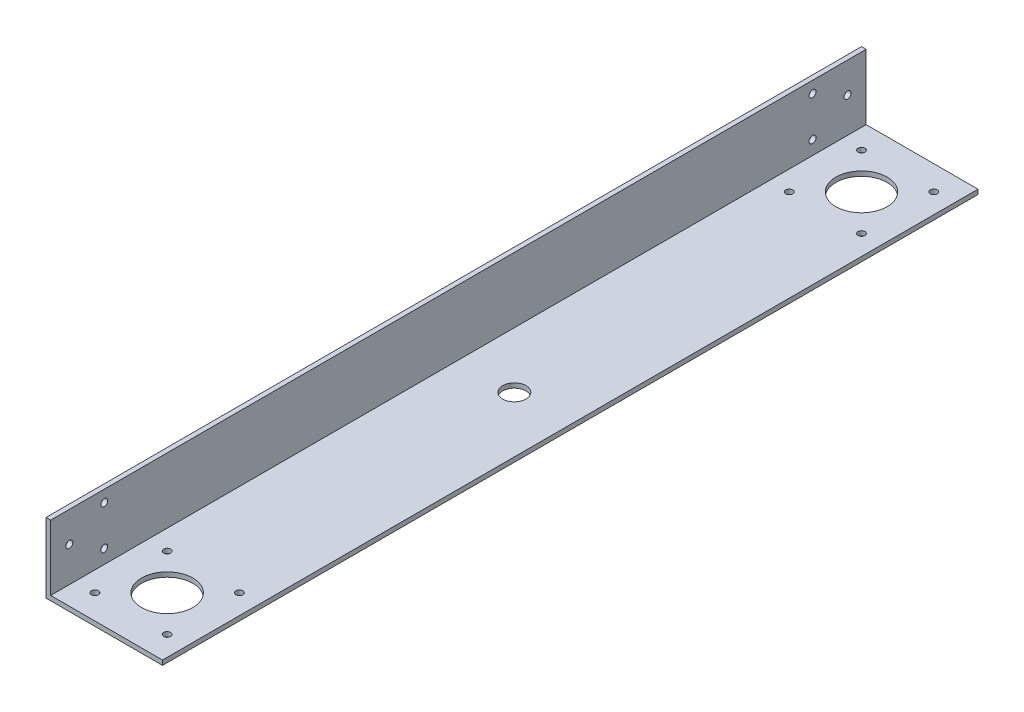
from build123d import *

# Parameters (mm, degrees)
BOSS_EXTRUDE1_DEPTH      = 350
SKETCH6_R                = 1.5
CUT_EXTRUDE3_DEPTH       = 355.660400947
SKETCH7_R                = 11
CUT_EXTRUDE4_DEPTH       = 355.660400947
SKETCH8_R                = 11
CUT_EXTRUDE5_DEPTH       = 355.823899984
SKETCH9_R                = 1.5
CUT_EXTRUDE6_DEPTH       = 355.823899984
SKETCH10_R               = 5
CUT_EXTRUDE7_DEPTH       = 355.823899984
F_3_0_3_DIAMETER_HOLE1_D = 3
F_3_0_3_DIAMETER_HOLE2_D = 3


with BuildPart() as part:
    # Sketch1 → Boss-Extrude1 (new body)
    with BuildSketch(Plane.XY):
        Polygon((0, 0), (0, 30), (2, 30), (2, 2), (50, 2), (50, 0), align=None)
    extrude(amount=BOSS_EXTRUDE1_DEPTH)

    # Sketch6 → Cut-Extrude3 (cut, through all)
    with BuildSketch(Plane(origin=(0, 2, 0), x_dir=(1, 0, 0), z_dir=(0, 1, 0))):
        with Locations((41.5, -339.5)):
            Circle(SKETCH6_R)
        with Locations((10.5, -308.5)):
            Circle(SKETCH6_R)
        with Locations((10.5, -339.5)):
            Circle(SKETCH6_R)
        with Locations((41.5, -308.5)):
            Circle(SKETCH6_R)
    extrude(amount=-CUT_EXTRUDE3_DEPTH, mode=Mode.SUBTRACT)

    # Sketch7 → Cut-Extrude4 (cut, through all)
    with BuildSketch(Plane(origin=(0, 2, 0), x_dir=(1, 0, 0), z_dir=(0, 1, 0))):
        with Locations((26, -324)):
            Circle(SKETCH7_R)
    extrude(amount=-CUT_EXTRUDE4_DEPTH, mode=Mode.SUBTRACT)

    # Sketch8 → Cut-Extrude5 (cut, through all)
    with BuildSketch(Plane(origin=(0, 0, 0), x_dir=(-1, 0, 0), z_dir=(0, -1, 0))):
        with Locations((-26, -26)):
            Circle(SKETCH8_R)
    extrude(amount=-CUT_EXTRUDE5_DEPTH, mode=Mode.SUBTRACT)

    # Sketch9 → Cut-Extrude6 (cut, through all)
    with BuildSketch(Plane.XZ):
        with Locations((41.5, 41.5)):
            Circle(SKETCH9_R)
        with Locations((10.5, 41.5)):
            Circle(SKETCH9_R)
        with Locations((10.5, 10.5)):
            Circle(SKETCH9_R)
        with Locations((41.5, 10.5)):
            Circle(SKETCH9_R)
    extrude(amount=-CUT_EXTRUDE6_DEPTH, mode=Mode.SUBTRACT)

    # Sketch10 → Cut-Extrude7 (cut, through all)
    with BuildSketch(Plane.XZ):
        with Locations((26.000000572, 175)):
            Circle(SKETCH10_R)
    extrude(amount=-CUT_EXTRUDE7_DEPTH, mode=Mode.SUBTRACT)

    # Ø3.0 (3) Diameter Hole1 (through all)
    with Locations(Plane(origin=(0, 141.67995168, 221.138003919), x_dir=(0, 0, 1), z_dir=(-1, 0, 0))):
        with Locations((105.861996081, -133.67995168), (120.861996081, -124.67995168), (105.861996081, -116.67995168)):
            Hole(F_3_0_3_DIAMETER_HOLE1_D / 2)

    # Ø3.0 (3) Diameter Hole2 (through all)
    with Locations(Plane(origin=(0, 141.67995168, 221.138003919), x_dir=(0, 0, 1), z_dir=(-1, 0, 0))):
        with Locations((-198.138003919, -133.67995168), (-213.138003919, -124.711209313), (-198.138003919, -116.67995168)):
            Hole(F_3_0_3_DIAMETER_HOLE2_D / 2)


solid = part.part
